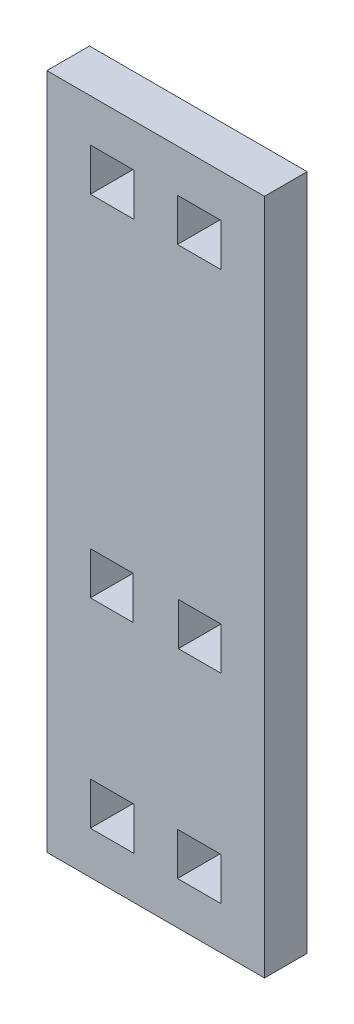
from build123d import *

# Parameters (mm, degrees)
SKETCH1_W           = 25.53
SKETCH1_H           = 79.4
BOSS_EXTRUDE1_DEPTH = 5
SKETCH2_W           = 5.106
SKETCH2_H           = 5
SKETCH2_W_2         = 5
CUT_EXTRUDE1_DEPTH  = 84.553221961


with BuildPart() as part:
    # Sketch1 → Boss-Extrude1 (new body)
    with BuildSketch(Plane.XY):
        with Locations((12.765, 39.7)):
            Rectangle(SKETCH1_W, SKETCH1_H)
    extrude(amount=BOSS_EXTRUDE1_DEPTH)

    # Sketch2 → Cut-Extrude1 (cut, through all)
    with BuildSketch(Plane.XY.offset(5)):
        with Locations((7.659, 71.9)):
            Rectangle(SKETCH2_W, SKETCH2_H)
        with Locations((17.871, 71.9)):
            Rectangle(SKETCH2_W, SKETCH2_H)
        with Locations((7.606, 30.9)):
            Rectangle(SKETCH2_W_2, SKETCH2_H)
        with Locations((17.924, 30.9)):
            Rectangle(SKETCH2_W_2, SKETCH2_H)
        with Locations((17.871, 7.5)):
            Rectangle(SKETCH2_W, SKETCH2_H)
        with Locations((7.659, 7.5)):
            Rectangle(SKETCH2_W, SKETCH2_H)
    extrude(amount=-CUT_EXTRUDE1_DEPTH, mode=Mode.SUBTRACT)


solid = part.part
